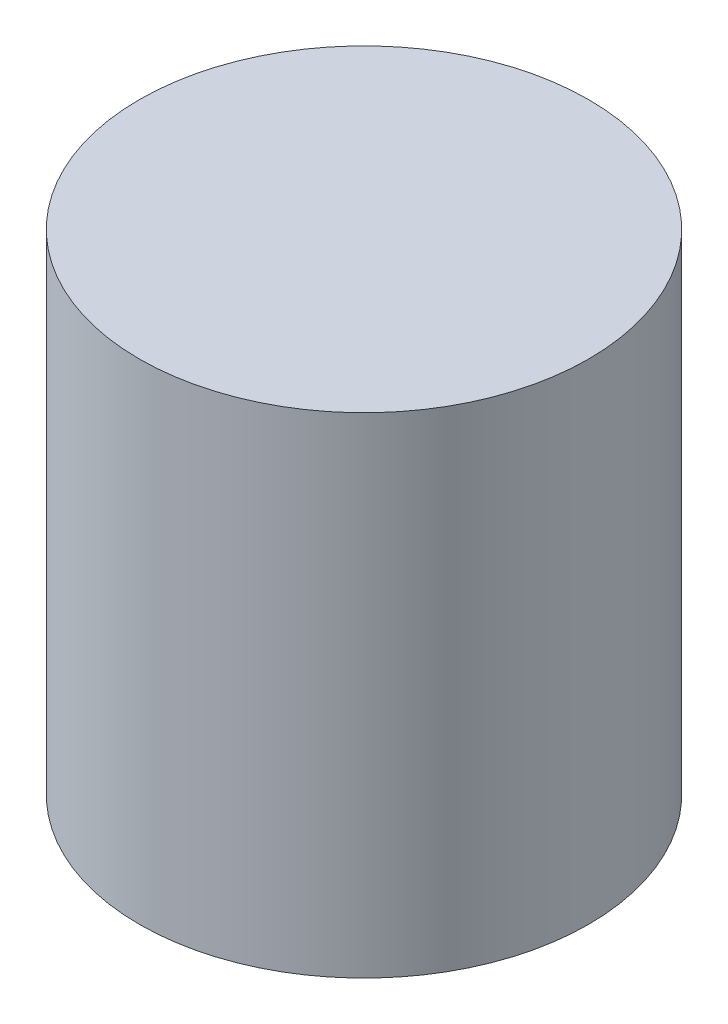
from build123d import *

# Parameters (mm, degrees)
SKETCH1_R           = 15.600223339
BOSS_EXTRUDE1_DEPTH = 34


with BuildPart() as part:
    # Sketch1 → Boss-Extrude1 (new body)
    with BuildSketch(Plane(origin=(0, 0, 0), x_dir=(1, 0, 0), z_dir=(0, 1, 0))):
        Circle(SKETCH1_R)
    extrude(amount=BOSS_EXTRUDE1_DEPTH)


solid = part.part
